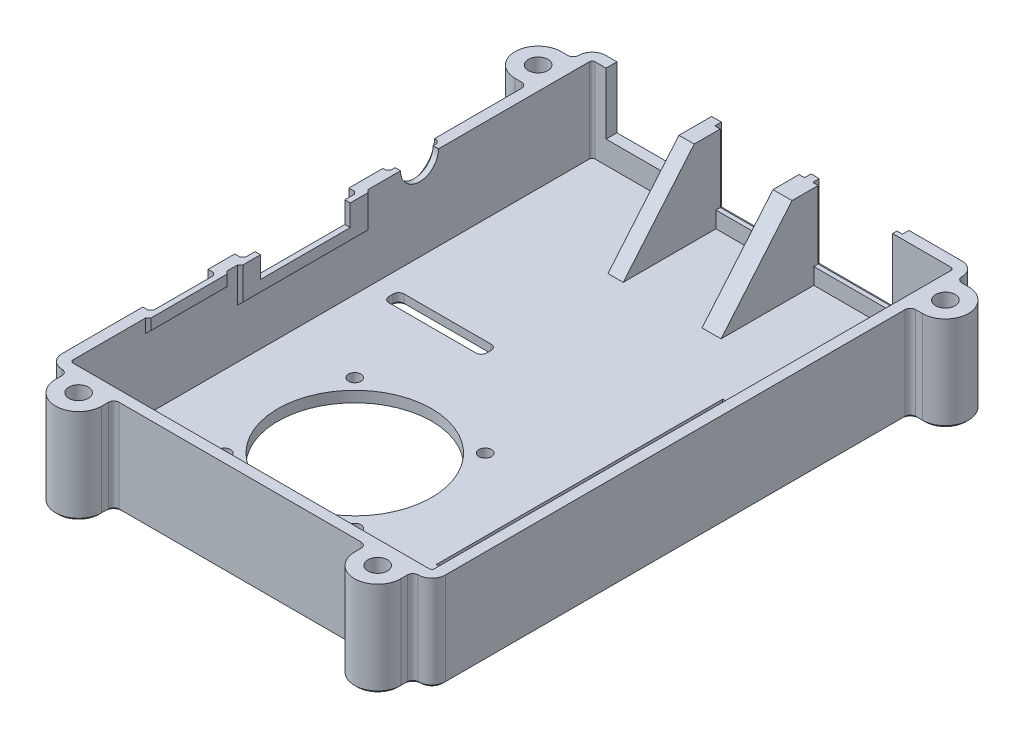
from build123d import *

# Parameters (mm, degrees)
BASE_DEPTH                      = 17.5
SHELL_T                         = -2
CLAMPS_DEPTH                    = 17.5
CLAMP_FILLETS_R                 = 1
SKETCH20_R                      = 1.8
CLAMP_HOLES_DEPTH               = 128.387411073
SKETCH21_R                      = 2.9
CLAMP_COUNTERSINKS_DEPTH        = 3.4
CLAMP_COUNTERSINK_CHAMFERS_SIZE = 0.3
SKETCH24_W                      = 14.5
SKETCH24_H                      = 12.5
USB_CUTOUT_DEPTH                = 18.25
SKETCH25_W                      = 16.5
SKETCH25_H                      = 13.5
USB_APPROACH_DEPTH              = 1.2
USB_INNER_SUPPORT_DEPTH         = 3.5
USB_OUTER_SUPPORT_DEPTH         = 2.8
SKETCH28_W                      = 17.4
SKETCH28_H                      = 11.3
RJ45_CUTOUT_DEPTH               = 22.7
SKETCH29_W                      = 15
SKETCH29_H                      = 2.5
SKETCH29_W_2                    = 24
SKETCH29_H_2                    = 6.43
HDMI_SUPPORT_DEPTH              = 0.5
HDMI_SUPPORT_CHAMFER_SIZE       = 0.5
SKETCH30_W                      = 21
SKETCH30_H                      = 5.93
SKETCH30_W_2                    = 12
SKETCH30_H_2                    = 2
HDMI_APPROACH_DEPTH             = 1.5
SKETCH31_W                      = 16.5
SKETCH31_H                      = 3.93
HDMI_CUTOUT_DEPTH               = 1
HDMI_APPROACH_CHAMFER_SIZE      = 0.5
SKETCH32_R                      = 3.5
AUDIO_CUTOUT_DEPTH              = 2
SKETCH33_R                      = 4.75
AUDIO_APPROACH_DEPTH            = 1
AUDIO_APPROACH_CHAMFER_SIZE     = 0.5
SKETCH34_W                      = 6
SKETCH34_H                      = 52.7
HEADER_CUTOUT_DEPTH             = 2
HEADER_COVER_DEPTH              = 1
SHELL_CHAMFER_SIZE              = 0.5
RIBBON_SLOT_DEPTH               = 2
RIBBON_SLOT_CHAMFER_SIZE        = 0.5
SKETCH39_R                      = 14.15
SKETCH39_R_2                    = 1.15
FAN_MOUNT_DEPTH                 = 2


with BuildPart() as part:
    # Sketch2 → Base (new body)
    with BuildSketch(Plane(origin=(0, 0, 0), x_dir=(1, 0, 0), z_dir=(0, 1, 0))):
        with BuildLine():
            Line((2.5, 0), (68, 0))
            ThreePointArc((68, 0), (69.767766953, 0.732233047), (70.5, 2.5))
            Line((70.5, 2.5), (70.5, 97.5))
            ThreePointArc((70.5, 97.5), (69.767766953, 99.267766953), (68, 100))
            Line((68, 100), (2.5, 100))
            ThreePointArc((2.5, 100), (0.732233047, 99.267766953), (0, 97.5))
            Line((0, 97.5), (0, 2.5))
            ThreePointArc((0, 2.5), (0.732233047, 0.732233047), (2.5, 0))
        make_face()
    extrude(amount=BASE_DEPTH)

    # Shell
    shell_openings = [part.faces().sort_by_distance(p)[0] for p in [
        (35.25, 17.5, -50),
    ]]
    offset(amount=SHELL_T, openings=shell_openings, kind=Kind.INTERSECTION)

    # Sketch14 → Clamps (add)
    with BuildSketch(Plane.XZ):
        with BuildLine():
            Line((-2.2, -88), (0, -88))
            Line((0, -88), (0, -96.5))
            Line((0, -96.5), (-2.2, -96.5))
            ThreePointArc((-2.2, -96.5), (-6.45, -92.25), (-2.2, -88))
        make_face()
        with BuildLine():
            Line((3.5, 2.2), (3.5, 0))
            Line((3.5, 0), (12, 0))
            Line((12, 0), (12, 2.2))
            ThreePointArc((12, 2.2), (7.75, 6.45), (3.5, 2.2))
        make_face()
        with BuildLine():
            Line((72.7, -88), (70.5, -88))
            Line((70.5, -88), (70.5, -96.5))
            Line((70.5, -96.5), (72.7, -96.5))
            ThreePointArc((72.7, -96.5), (76.95, -92.25), (72.7, -88))
        make_face()
        with BuildLine():
            Line((58.5, 0), (58.5, 2.2))
            ThreePointArc((58.5, 2.2), (62.75, 6.45), (67, 2.2))
            Line((67, 2.2), (67, 0))
            Line((67, 0), (58.5, 0))
        make_face()
    extrude(amount=-CLAMPS_DEPTH)

    # Clamp Fillets
    clamp_fillets_edges = [part.edges().sort_by_distance(p)[0] for p in [
        (0, 8.75, -96.5),
        (0, 8.75, -88),
        (3.5, 8.75, 0),
        (12, 8.75, 0),
        (70.5, 8.75, -88),
        (70.5, 8.75, -96.5),
        (58.5, 8.75, 0),
        (67, 8.75, 0),
    ]]
    fillet(clamp_fillets_edges, radius=CLAMP_FILLETS_R - 0.0001)  # a hair under: the kernel refuses the full size

    # Sketch20 → Clamp Holes (cut, through all)
    with BuildSketch(Plane.XZ):
        with Locations(Location((7.75, 2.2, 0), (0, 0, 270))):
            Circle(SKETCH20_R)
        with Locations(Location((62.75, 2.2, 0), (0, 0, 270))):
            Circle(SKETCH20_R)
        with Locations(Location((72.7, -92.25, 0), (0, 0, 270))):
            Circle(SKETCH20_R)
        with Locations(Location((-2.2, -92.25, 0), (0, 0, 270))):
            Circle(SKETCH20_R)
    extrude(amount=-CLAMP_HOLES_DEPTH, mode=Mode.SUBTRACT)

    # Sketch21 → Clamp Countersinks (cut)
    with BuildSketch(Plane.XZ):
        with Locations(Location((7.75, 2.2, 0), (0, 0, 270))):
            Circle(SKETCH21_R)
        with Locations(Location((62.75, 2.2, 0), (0, 0, 270))):
            Circle(SKETCH21_R)
        with Locations(Location((72.7, -92.25, 0), (0, 0, 270))):
            Circle(SKETCH21_R)
        with Locations(Location((-2.2, -92.25, 0), (0, 0, 270))):
            Circle(SKETCH21_R)
    extrude(amount=-CLAMP_COUNTERSINKS_DEPTH, mode=Mode.SUBTRACT)

    # Clamp Countersink Chamfers
    clamp_countersink_chamfers_edges = [part.edges().sort_by_distance(p)[0] for p in [
        (-2.2, 0, -89.35),
        (72.7, 0, -89.35),
        (62.75, 0, 5.1),
        (7.75, 0, 5.1),
    ]]
    chamfer(clamp_countersink_chamfers_edges, length=CLAMP_COUNTERSINK_CHAMFERS_SIZE)

    # Sketch24 → USB Cutout (cut)
    with BuildSketch(Plane(origin=(0, 0, -100), x_dir=(-1, 0, 0), z_dir=(0, 0, -1))):
        with Locations((-50, 11.25)):
            Rectangle(SKETCH24_W, SKETCH24_H)
        with Locations((-32, 11.25)):
            Rectangle(SKETCH24_W, SKETCH24_H)
    extrude(amount=-USB_CUTOUT_DEPTH, mode=Mode.SUBTRACT)

    # Sketch25 → USB Approach (cut)
    with BuildSketch(Plane(origin=(0, 0, -100), x_dir=(-1, 0, 0), z_dir=(0, 0, -1))):
        with Locations((-50, 10.75)):
            Rectangle(SKETCH25_W, SKETCH25_H)
        with Locations((-32, 10.75)):
            Rectangle(SKETCH25_W, SKETCH25_H)
    extrude(amount=-USB_APPROACH_DEPTH, mode=Mode.SUBTRACT)

    # Sketch26 → USB Inner Support (add)
    with BuildSketch(Plane(origin=(42.75, 0, 0), x_dir=(0, 0, -1), z_dir=(1, 0, 0))):
        Polygon((98, 2), (98, 17.5), (94, 17.5), (80.95, 2), align=None)
    extrude(amount=-USB_INNER_SUPPORT_DEPTH)

    # Sketch27 → USB Outer Support (add)
    with BuildSketch(Plane(origin=(24.75, 0, 0), x_dir=(0, 0, -1), z_dir=(1, 0, 0))):
        Polygon((98, 2), (98, 17.5), (94, 17.5), (80.95, 2), align=None)
    extrude(amount=-USB_OUTER_SUPPORT_DEPTH)

    # Sketch28 → RJ45 Cutout (cut)
    with BuildSketch(Plane(origin=(0, 0, -100), x_dir=(-1, 0, 0), z_dir=(0, 0, -1))):
        with Locations((-13.25, 11.85)):
            Rectangle(SKETCH28_W, SKETCH28_H)
    extrude(amount=-RJ45_CUTOUT_DEPTH, mode=Mode.SUBTRACT)

    # Sketch29 → HDMI Support (add)
    with BuildSketch(Plane(origin=(2, 0, 0), x_dir=(0, 0, -1), z_dir=(1, 0, 0))):
        with Locations((23.35, 16.25)):
            Rectangle(SKETCH29_W, SKETCH29_H)
        with Locations((44.75, 14.285)):
            Rectangle(SKETCH29_W_2, SKETCH29_H_2)
    extrude(amount=HDMI_SUPPORT_DEPTH)

    # HDMI Support Chamfer
    hdmi_support_chamfer_edges = [part.edges().sort_by_distance(p)[0] for p in [
        (2.5, 14.285, -56.75),
        (2.5, 11.07, -44.75),
        (2.5, 14.285, -32.75),
        (2.5, 16.25, -30.85),
        (2.5, 15, -23.35),
        (2.5, 16.25, -15.85),
    ]]
    chamfer(hdmi_support_chamfer_edges, length=HDMI_SUPPORT_CHAMFER_SIZE - 0.0001)  # a hair under: the kernel refuses the full size

    # Sketch30 → HDMI Approach (cut)
    with BuildSketch(Plane.ZY):
        with Locations((-44.75, 14.535)):
            Rectangle(SKETCH30_W, SKETCH30_H)
        with Locations((-23.35, 16.5)):
            Rectangle(SKETCH30_W_2, SKETCH30_H_2)
    extrude(amount=-HDMI_APPROACH_DEPTH, mode=Mode.SUBTRACT)

    # Sketch31 → HDMI Cutout (cut)
    with BuildSketch(Plane.ZY.offset(-1.5)):
        with Locations((-44.75, 15.535)):
            Rectangle(SKETCH31_W, SKETCH31_H)
    extrude(amount=-HDMI_CUTOUT_DEPTH, mode=Mode.SUBTRACT)

    # HDMI Approach Chamfer
    hdmi_approach_chamfer_edges = [part.edges().sort_by_distance(p)[0] for p in [
        (1.5, 14.535, -34.25),
        (1.5, 11.57, -44.75),
        (1.5, 14.535, -55.25),
        (1.5, 16.5, -29.35),
        (1.5, 16.5, -17.35),
        (1.5, 15.5, -23.35),
    ]]
    chamfer(hdmi_approach_chamfer_edges, length=HDMI_APPROACH_CHAMFER_SIZE)

    # Sketch32 → Audio Cutout (cut)
    with BuildSketch(Plane.ZY):
        with Locations((-66.25, 17.5)):
            Circle(SKETCH32_R)
    extrude(amount=-AUDIO_CUTOUT_DEPTH, mode=Mode.SUBTRACT)

    # Sketch33 → Audio Approach (cut)
    with BuildSketch(Plane.ZY):
        with Locations((-66.25, 17.5)):
            Circle(SKETCH33_R)
    extrude(amount=-AUDIO_APPROACH_DEPTH, mode=Mode.SUBTRACT)

    # Audio Approach Chamfer
    audio_approach_chamfer_edges = [part.edges().sort_by_distance(p)[0] for p in [
        (1, 12.75, -66.25),
    ]]
    chamfer(audio_approach_chamfer_edges, length=AUDIO_APPROACH_CHAMFER_SIZE)

    # Sketch34 → Header Cutout (cut)
    with BuildSketch(Plane.XZ):
        with Locations((55.5, -45.15)):
            Rectangle(SKETCH34_W, SKETCH34_H)
    extrude(amount=-HEADER_CUTOUT_DEPTH, mode=Mode.SUBTRACT)

    # Sketch35 → Header Cover (add)
    with BuildSketch(Plane.XZ):
        Polygon((56, -18.8), (55, -18.8), (55, -19.8), (53.5, -19.8), (53.5, -24.7625), (52.5, -24.7625), (52.5, -25.7625), (53.5, -25.7625), (53.5, -37.6875), (52.5, -37.6875), (52.5, -38.6875), (53.5, -38.6875), (53.5, -43.65), (55, -43.65), (55, -44.65), (52.5, -44.65), (52.5, -45.65), (55, -45.65), (55, -46.65), (53.5, -46.65), (53.5, -51.6125), (52.5, -51.6125), (52.5, -52.6125), (53.5, -52.6125), (53.5, -64.5375), (52.5, -64.5375), (52.5, -65.5375), (53.5, -65.5375), (53.5, -70.5), (55, -70.5), (55, -71.5), (56, -71.5), (56, -70.5), (57.5, -70.5), (57.5, -65.5375), (58.5, -65.5375), (58.5, -64.5375), (57.5, -64.5375), (57.5, -52.6125), (58.5, -52.6125), (58.5, -51.6125), (57.5, -51.6125), (57.5, -46.65), (56, -46.65), (56, -45.65), (58.5, -45.65), (58.5, -44.65), (56, -44.65), (56, -43.65), (57.5, -43.65), (57.5, -38.6875), (58.5, -38.6875), (58.5, -37.6875), (57.5, -37.6875), (57.5, -25.7625), (58.5, -25.7625), (58.5, -24.7625), (57.5, -24.7625), (57.5, -19.8), (56, -19.8), align=None)
    extrude(amount=-HEADER_COVER_DEPTH)

    # Shell Chamfer
    shell_chamfer_edges = [part.edges().sort_by_distance(p)[0] for p in [
        (-1.59995, 0, -88),
        (72.09995, 0, -96.5),
        (58.207136071, 0, 0.292863929),
        (0.732233047, 0, -0.732233047),
        (67.292863929, 0, 0.292863929),
        (12.292863929, 0, 0.292863929),
        (3.207136071, 0, 0.292863929),
        (-0.292863929, 0, -96.792863929),
        (-0.292863929, 0, -87.707136071),
        (70.792863929, 0, -87.707136071),
        (70.792863929, 0, -96.792863929),
        (-6.45, 0, -92.25),
        (-1.59995, 0, -96.5),
        (52.5, 0, -21.78125),
        (53.75, 0, -71.5),
        (58.5, 0, -68.51875),
        (57.25, 0, -18.8),
        (57.25, 0, -71.5),
        (58.5, 0, -58.575),
        (58.5, 0, -48.63125),
        (58.5, 0, -41.66875),
        (58.5, 0, -31.725),
        (58.5, 0, -21.78125),
        (53.75, 0, -18.8),
        (52.5, 0, -31.725),
        (52.5, 0, -41.66875),
        (52.5, 0, -48.63125),
        (52.5, 0, -58.575),
        (52.5, 0, -68.51875),
        (7.75, 0, 6.45),
        (3.5, 0, 1.59995),
        (76.95, 0, -92.25),
        (72.09995, 0, -88),
        (62.75, 0, 6.45),
        (58.5, 0, 1.59995),
        (0.732233047, 0, -99.267766953),
        (35.25, 0, -100),
        (69.767766953, 0, -99.267766953),
        (35.25, 0, 0),
        (70.5, 0, -44.75005),
        (67, 0, 1.59995),
        (12, 0, 1.59995),
        (69.767766953, 0, -0.732233047),
        (0, 0, -44.75005),
    ]]
    chamfer(shell_chamfer_edges, length=SHELL_CHAMFER_SIZE)

    # Sketch38 → Ribbon Slot (cut)
    with BuildSketch(Plane.XZ):
        with BuildLine():
            Line((6.45, -56.157), (22.45, -56.157))
            ThreePointArc((22.45, -56.157), (23.157106781, -56.449893219), (23.45, -57.157))
            Line((23.45, -57.157), (23.45, -57.957))
            ThreePointArc((23.45, -57.957), (23.157106781, -58.664106781), (22.45, -58.957))
            Line((22.45, -58.957), (6.45, -58.957))
            ThreePointArc((6.45, -58.957), (5.742893219, -58.664106781), (5.45, -57.957))
            Line((5.45, -57.957), (5.45, -57.157))
            ThreePointArc((5.45, -57.157), (5.742893219, -56.449893219), (6.45, -56.157))
        make_face()
    extrude(amount=-RIBBON_SLOT_DEPTH, mode=Mode.SUBTRACT)

    # Ribbon Slot Chamfer
    ribbon_slot_chamfer_edges = [part.edges().sort_by_distance(p)[0] for p in [
        (23.157106781, 0, -56.449893219),
        (14.45, 0, -56.157),
        (5.742893219, 0, -56.449893219),
        (5.45, 0, -57.557),
        (5.742893219, 0, -58.664106781),
        (14.45, 0, -58.957),
        (23.157106781, 0, -58.664106781),
        (23.45, 0, -57.557),
    ]]
    chamfer(ribbon_slot_chamfer_edges, length=RIBBON_SLOT_CHAMFER_SIZE)

    # Sketch39 → Fan Mount (cut)
    with BuildSketch(Plane.XZ):
        with Locations(Location((27.25, -29.0785, 0), (0, 0, 270))):
            Circle(SKETCH39_R)
        with Locations(Location((39.250026341, -17.078473659, 0), (0, 0, 270))):
            Circle(SKETCH39_R_2)
        with Locations(Location((39.250026341, -41.078526341, 0), (0, 0, 270))):
            Circle(SKETCH39_R_2)
        with Locations(Location((15.249973659, -41.078526341, 0), (0, 0, 270))):
            Circle(SKETCH39_R_2)
        with Locations(Location((15.249973659, -17.078473659, 0), (0, 0, 270))):
            Circle(SKETCH39_R_2)
    extrude(amount=-FAN_MOUNT_DEPTH, mode=Mode.SUBTRACT)


solid = part.part
